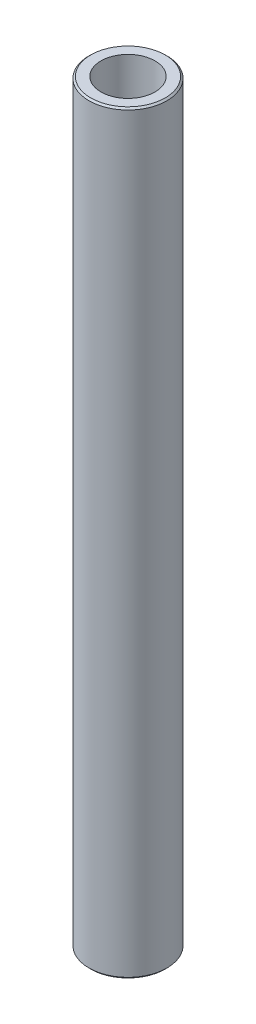
from build123d import *
from OCP.BRepFilletAPI import BRepFilletAPI_MakeChamfer

# Parameters (mm, degrees)
SKETCH1_R           = 10
BOSS_EXTRUDE1_DEPTH = 193.69387927
SKETCH2_R           = 6.934096714
CUT_EXTRUDE1_DEPTH  = 195.209471619
CHAMFER1_SIZE       = 0.41366235
CHAMFER1_SIZE2      = 0.437176571


with BuildPart() as part:
    # Sketch1 → Boss-Extrude1 (new body)
    with BuildSketch(Plane(origin=(0, 0, 0), x_dir=(1, 0, 0), z_dir=(0, 1, 0))):
        Circle(SKETCH1_R)
    extrude(amount=BOSS_EXTRUDE1_DEPTH)

    # Sketch2 → Cut-Extrude1 (cut, through all)
    with BuildSketch(Plane(origin=(0, 0, 0), x_dir=(1, 0, 0), z_dir=(0, 1, 0))):
        Circle(SKETCH2_R)
    extrude(amount=CUT_EXTRUDE1_DEPTH, mode=Mode.SUBTRACT)

    # Chamfer1: one chamfer whose edges measure the first distance from different faces: ONE call of the kernel's chamfer builder (chamfer() names one face for all edges)
    chamfer1_edges_1 = [part.edges().sort_by_distance(p)[0] for p in [
        (-10, 193.69387927, 0),
    ]]
    chamfer1_side_1 = [part.faces().sort_by_distance(p)[0] for p in [
        (-10, 96.846939635, 0),
    ]]
    chamfer1_edges_2 = [part.edges().sort_by_distance(p)[0] for p in [
        (-10, 0, 0),
    ]]
    chamfer1_side_2 = [part.faces().sort_by_distance(p)[0] for p in [
        (-9.717157288, 0, 0),
    ]]
    chamfer1 = BRepFilletAPI_MakeChamfer(part.part.solid().wrapped)
    for e in chamfer1_edges_1:
        chamfer1.Add(CHAMFER1_SIZE, CHAMFER1_SIZE2, e.wrapped, chamfer1_side_1[0].wrapped)  # the first distance lies on this face
    for e in chamfer1_edges_2:
        chamfer1.Add(CHAMFER1_SIZE, CHAMFER1_SIZE2, e.wrapped, chamfer1_side_2[0].wrapped)  # the first distance lies on this face
    add(Compound.cast(chamfer1.Shape()), mode=Mode.REPLACE)


solid = part.part
